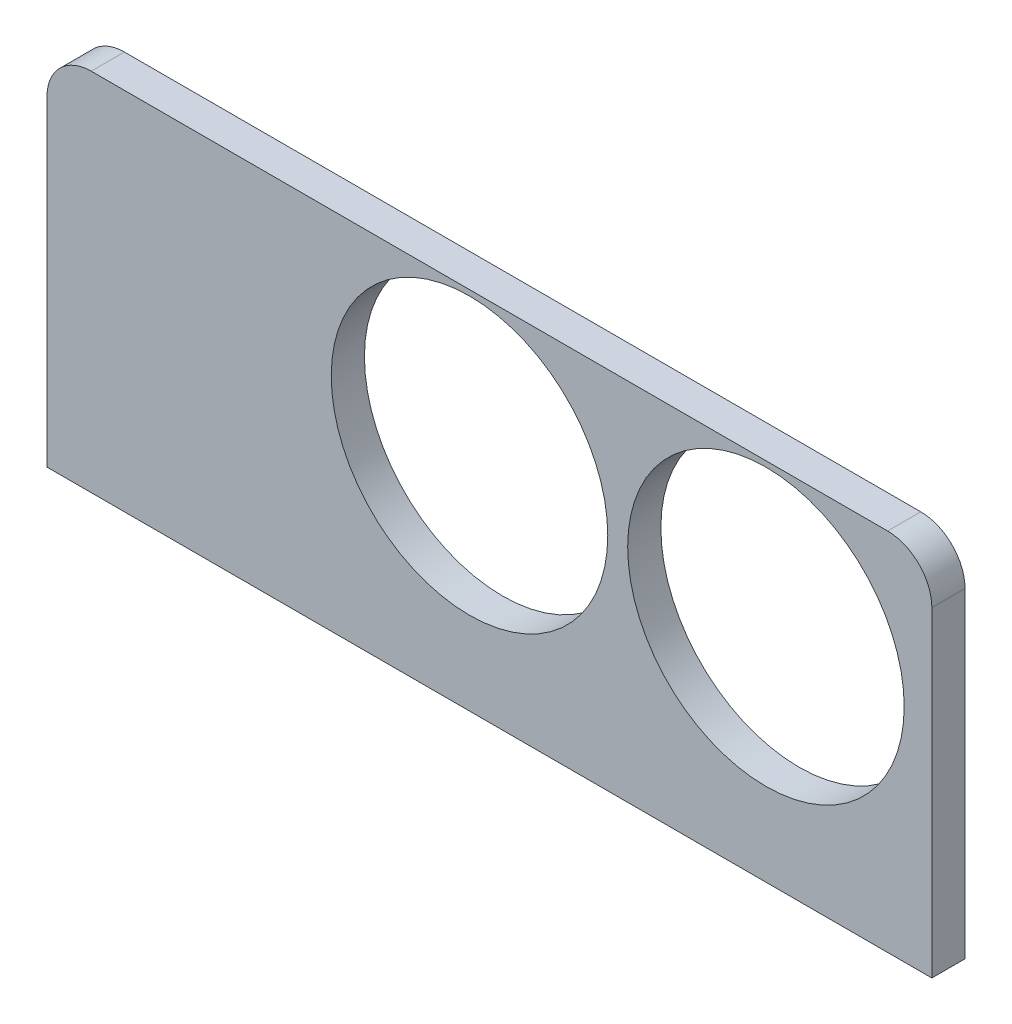
from build123d import *

# Parameters (mm, degrees)
SKETCH1_W           = 40
SKETCH1_H           = 16.5
SKETCH1_R           = 6.25
BOSS_EXTRUDE1_DEPTH = 1.5
FILLET1_R           = 2


with BuildPart() as part:
    # Sketch1 → Boss-Extrude1 (new body)
    with BuildSketch(Plane.XY):
        Rectangle(SKETCH1_W, SKETCH1_H)
        with Locations((-0.9, 1.75)):
            Circle(SKETCH1_R, mode=Mode.SUBTRACT)
        with Locations((12.5, 1.75)):
            Circle(SKETCH1_R, mode=Mode.SUBTRACT)
    extrude(amount=BOSS_EXTRUDE1_DEPTH)

    # Fillet1
    fillet1_edges = [part.edges().sort_by_distance(p)[0] for p in [
        (20, 8.25, 0.75),
        (-20, 8.25, 0.75),
    ]]
    fillet(fillet1_edges, radius=FILLET1_R)


solid = part.part
